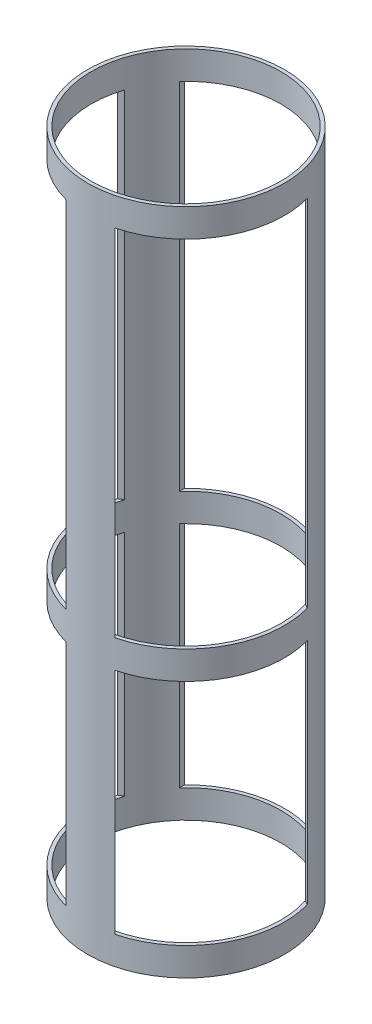
from build123d import *

# Parameters (mm, degrees)
SKETCH1_R               = 88.9
SKETCH1_R_2             = 85.725
BOSS_EXTRUDE1_DEPTH     = 301.625
CUT_EXTRUDE1_REACH      = 328.778
CUT_EXTRUDE1_END_RADIUS = 88.9
SKETCH2_W               = 127
SKETCH2_H               = 206.502
SKETCH2_H_2             = 320.548
CIRPATTERN1_COUNT       = 3


with BuildPart() as part:
    # Sketch1 → Boss-Extrude1 (new, symmetric)
    with BuildSketch(Plane(origin=(0, 0, 0), x_dir=(1, 0, 0), z_dir=(0, 1, 0))):
        Circle(SKETCH1_R)
        Circle(SKETCH1_R_2, mode=Mode.SUBTRACT)
    extrude(amount=BOSS_EXTRUDE1_DEPTH, both=True)

    # Cut-Extrude1: up to this cylinder (the profile starts inside it)
    cut_extrude1_end = Plane(origin=(0, -28.5115, 0), z_dir=(0, -1, 0)) * Cylinder(CUT_EXTRUDE1_END_RADIUS, 1125.281, mode=Mode.PRIVATE)
    # Sketch2 → Cut-Extrude1 (cut, up to the surface)
    with BuildSketch(Plane.XY, mode=Mode.PRIVATE) as cut_extrude1_sk1:
        with Locations((0, -172.974)):
            Rectangle(SKETCH2_W, SKETCH2_H)
    cut_extrude1_tool1 = extrude(cut_extrude1_sk1.sketch, amount=-CUT_EXTRUDE1_REACH, mode=Mode.PRIVATE) & cut_extrude1_end
    # Sketch2 → Cut-Extrude1 (cut, up to the surface)
    with BuildSketch(Plane.XY, mode=Mode.PRIVATE) as cut_extrude1_sk2:
        with Locations((0, 115.951)):
            Rectangle(SKETCH2_W, SKETCH2_H_2)
    cut_extrude1_tool2 = extrude(cut_extrude1_sk2.sketch, amount=-CUT_EXTRUDE1_REACH, mode=Mode.PRIVATE) & cut_extrude1_end
    cut_extrude1 = cut_extrude1_tool1.solids().sort_by_distance((0, -172.974, 0))[0] + cut_extrude1_tool2.solids().sort_by_distance((0, 115.951, 0))[0]
    add(cut_extrude1, mode=Mode.SUBTRACT)

    # CirPattern1: Cut-Extrude1 ×3 about axis
    cirpattern1_axis = Axis((0, 301.625, 0), (0, -1, 0))
    for i in range(1, CIRPATTERN1_COUNT):
        add(cut_extrude1.rotate(cirpattern1_axis, i * 360 / CIRPATTERN1_COUNT), mode=Mode.SUBTRACT)


solid = part.part
